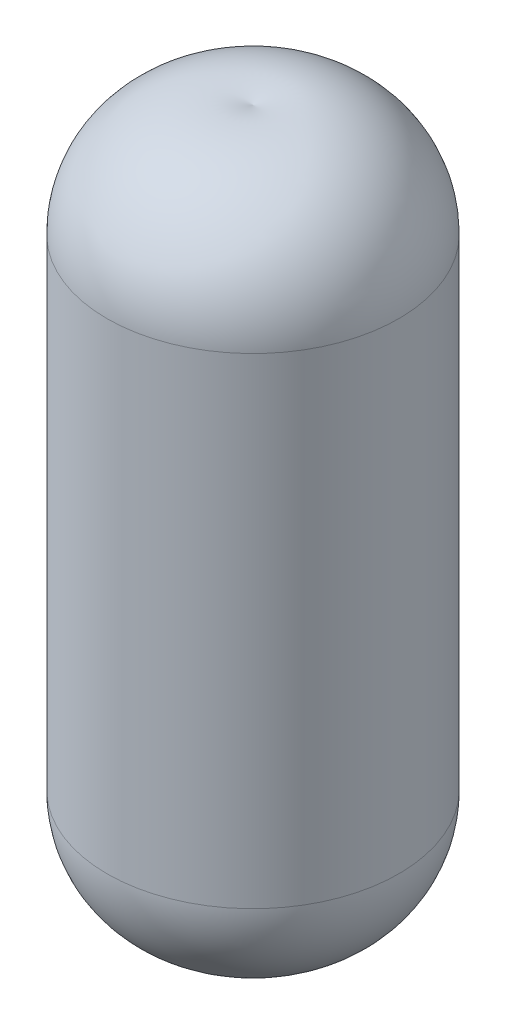
from build123d import *


with BuildPart() as part:
    # Sketch1 → Revolve2 (revolve)
    with BuildSketch(Plane.XY):
        with BuildLine():
            Line((0, 1509.902), (0, -522.098))
            Line((0, -522.098), (0, -979.298))
            ThreePointArc((0, -979.298), (420.224017952, -895.102637972), (609.6, -510.637006642))
            Line((609.6, -510.637006642), (609.6, 1498.441006642))
            ThreePointArc((609.6, 1498.441006642), (420.224017952, 1882.906637972), (0, 1967.102))
            Line((0, 1967.102), (0, 1509.902))
        make_face()
    revolve(axis=Axis((0, 550, 0), (0, -1, 0)))


solid = part.part
